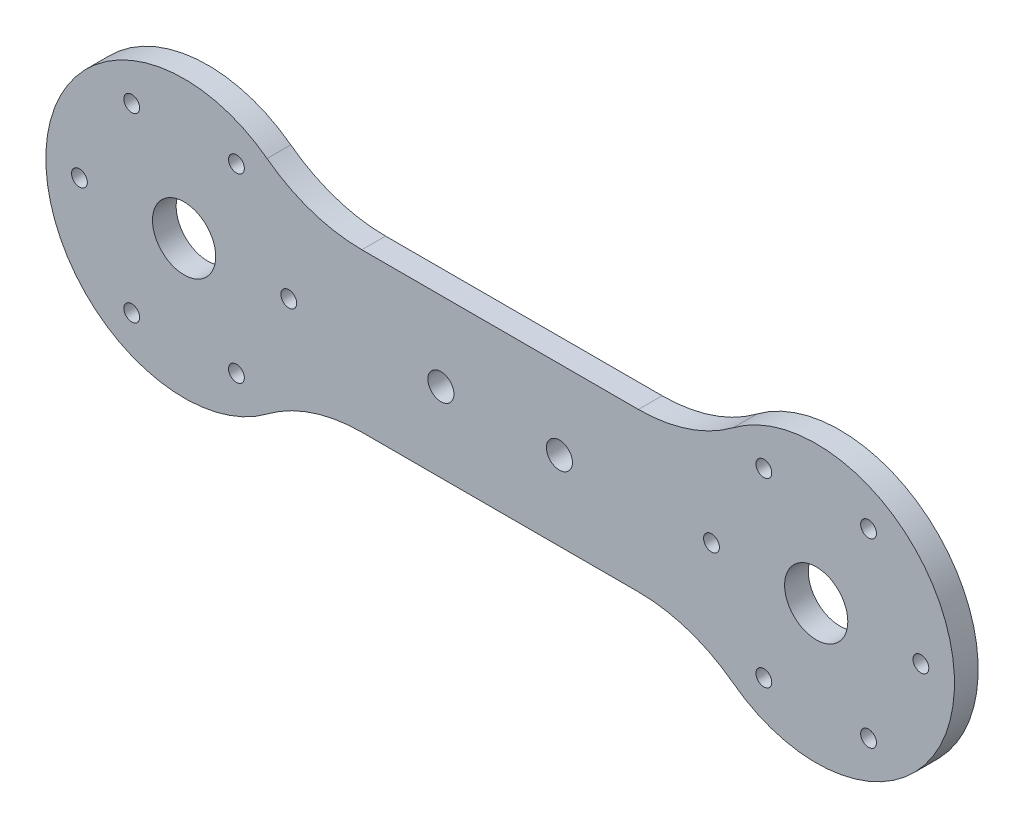
from build123d import *

# Parameters (mm, degrees)
ESBO_O1_R                = 1
ESBO_O1_R_2              = 4
ESBO_O1_R_3              = 1.65
RESSALTO_EXTRUS_O1_DEPTH = 3
FILETE1_R                = 20


with BuildPart() as part:
    # Esboço1 → Ressalto-extrusão1 (new body)
    with BuildSketch(Plane.XY):
        with BuildLine():
            ThreePointArc((14.361406616, 10), (-17.5, 0), (14.361406616, -10))
            Line((14.361406616, -10), (65.638593384, -10))
            ThreePointArc((65.638593384, -10), (97.5, 0), (65.638593384, 10))
            Line((65.638593384, 10), (14.361406616, 10))
        make_face()
        with Locations((-6.625, -11.4748366)):
            Circle(ESBO_O1_R, mode=Mode.SUBTRACT)
        with Locations((6.625, -11.4748366)):
            Circle(ESBO_O1_R, mode=Mode.SUBTRACT)
        with Locations((-13.25, 0)):
            Circle(ESBO_O1_R, mode=Mode.SUBTRACT)
        Circle(ESBO_O1_R_2, mode=Mode.SUBTRACT)
        with Locations((13.25, 0)):
            Circle(ESBO_O1_R, mode=Mode.SUBTRACT)
        with Locations((32.5, 0)):
            Circle(ESBO_O1_R_3, mode=Mode.SUBTRACT)
        with Locations((73.375, -11.4748366)):
            Circle(ESBO_O1_R, mode=Mode.SUBTRACT)
        with Locations((86.625, -11.4748366)):
            Circle(ESBO_O1_R, mode=Mode.SUBTRACT)
        with Locations((66.75, 0)):
            Circle(ESBO_O1_R, mode=Mode.SUBTRACT)
        with Locations((80, 0)):
            Circle(ESBO_O1_R_2, mode=Mode.SUBTRACT)
        with Locations((93.25, 0)):
            Circle(ESBO_O1_R, mode=Mode.SUBTRACT)
        with Locations((-6.625, 11.4748366)):
            Circle(ESBO_O1_R, mode=Mode.SUBTRACT)
        with Locations((6.625, 11.4748366)):
            Circle(ESBO_O1_R, mode=Mode.SUBTRACT)
        with Locations((47.5, 0)):
            Circle(ESBO_O1_R_3, mode=Mode.SUBTRACT)
        with Locations((73.375, 11.4748366)):
            Circle(ESBO_O1_R, mode=Mode.SUBTRACT)
        with Locations((86.625, 11.4748366)):
            Circle(ESBO_O1_R, mode=Mode.SUBTRACT)
    extrude(amount=RESSALTO_EXTRUS_O1_DEPTH)

    # Filete1
    filete1_edges = [part.edges().sort_by_distance(p)[0] for p in [
        (14.361406616, -10, 1.5),
        (65.638593384, -10, 1.5),
        (65.638593384, 10, 1.5),
        (14.361406616, 10, 1.5),
    ]]
    fillet(filete1_edges, radius=FILETE1_R)


solid = part.part
